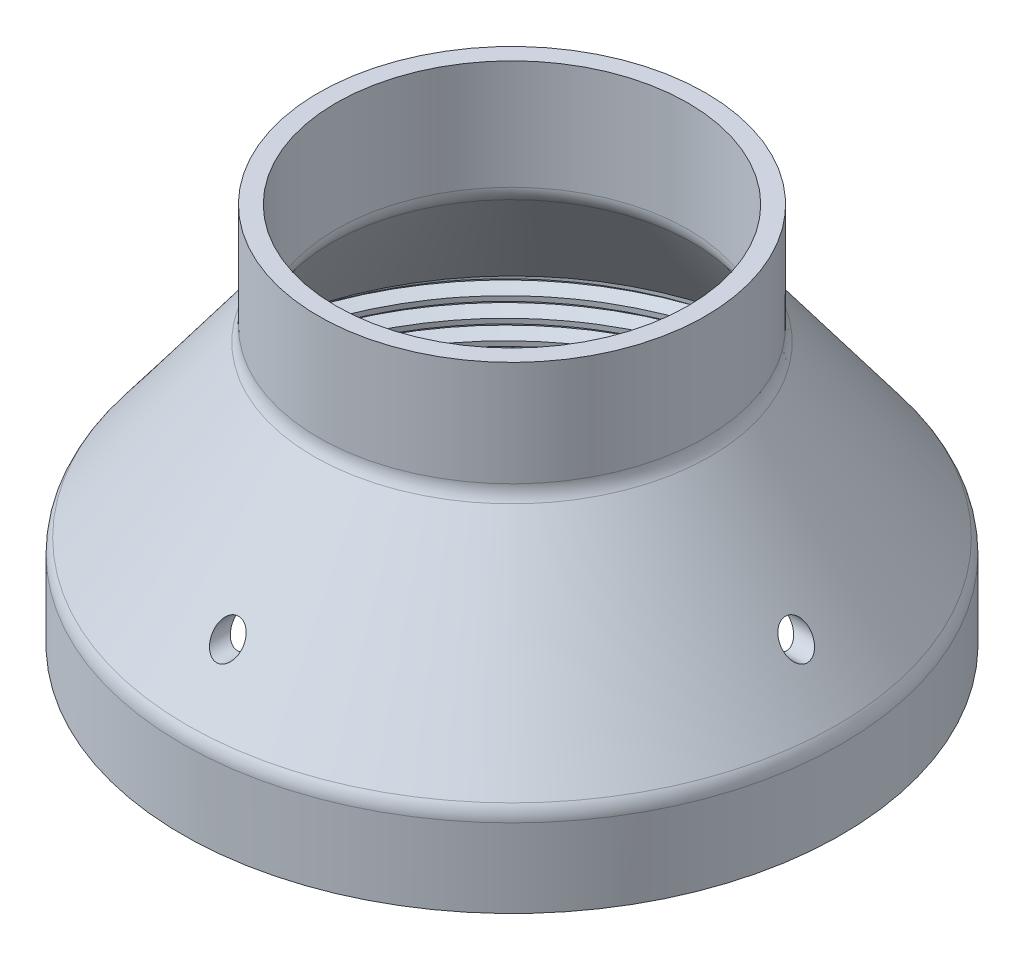
from build123d import *

# Parameters (mm, degrees)
CHAMFER1_SIZE      = 2.54
THREAD1_PITCH      = 2.116666667
FILLET1_R          = 2.54
SKETCH6_R          = 1.5875
CUT_EXTRUDE2_DEPTH = 66.197773391
CIRPATTERN1_COUNT  = 4


with BuildPart() as part:
    # Sketch1 → Revolve1 (revolve)
    with BuildSketch(Plane.XY, mode=Mode.PRIVATE) as revolve1_sk:
        Polygon((35.687, 0), (35.687, 9.343833915), (20.955, 29.039021081), (20.955, 41.275), (19.05, 41.275), (19.05, 28.575), (30.9245, 12.7), (30.9245, 0), align=None)
    revolve(revolve1_sk.sketch.rotate(Axis((0, 0, 0), (0, 1, 0)), 90), axis=Axis((0, 0, 0), (0, 1, 0)))

    # Chamfer1
    chamfer1_edges = [part.edges().sort_by_distance(p)[0] for p in [
        (0, 0, 30.9245),
    ]]
    chamfer(chamfer1_edges, length=CHAMFER1_SIZE)

    # Thread1: the profile of Thread Profile1 profile screwed along a right-hand helix of 6 turns, 10 arcs to a turn; built about Z, then put on its axis
    thread1_z = Axis((0, 0, 0), (0, 0, 1))
    thread1_corners = [(30.9242, 0, -0.000173205), (32.070179435, 0, 0.66145833), (32.070179435, 0, 0.926041664), (30.9242, 0, 1.587673199)]
    with BuildLine(mode=Mode.PRIVATE) as thread1_profile:
        Line(thread1_corners[0], thread1_corners[1])
        Line(thread1_corners[1], thread1_corners[2])
        Line(thread1_corners[2], thread1_corners[3])
        Line(thread1_corners[3], thread1_corners[0])
    thread1_cap = Face(thread1_profile.wire())
    thread1_turn_angles = [0, 18, 36, 54, 72, 90, 108, 126, 144, 162, 180, 198, 216, 234, 252, 270, 288, 306, 324, 342, 360]
    thread1_turn_weights = [1, 0.9510565162951535, 1, 0.9510565162951535, 1, 0.9510565162951535, 1, 0.9510565162951535, 1, 0.9510565162951535, 1, 0.9510565162951535, 1, 0.9510565162951535, 1, 0.9510565162951535, 1, 0.9510565162951535, 1, 0.9510565162951535, 1]
    thread1_turn_rails = [Edge.make_bspline([Vector(p[0], p[1], 0).rotate(thread1_z, thread1_turn_angles[k]) / thread1_turn_weights[k] + Vector(0, 0, p[2] + THREAD1_PITCH * thread1_turn_angles[k] / 360) for k in range(21)], [0, 0, 0, 1, 1, 2, 2, 3, 3, 4, 4, 5, 5, 6, 6, 7, 7, 8, 8, 9, 9, 10, 10, 10], 2, thread1_turn_weights) for p in thread1_corners]
    thread1_turn_sides = [Face.make_surface_from_curves(thread1_turn_rails[p[0]], thread1_turn_rails[p[1]]) for p in [(0, 1), (1, 2), (2, 3), (3, 0)]]
    thread1 = Plane(origin=(0, 12.7, 0), x_dir=(-1, 0, 0), z_dir=(0, -1, 0)) * Solid(Shell([*[p.moved(Location((0, 0, THREAD1_PITCH * i))) for i in range(6) for p in thread1_turn_sides], thread1_cap, thread1_cap.rotate(thread1_z, 2160).moved(Location((0, 0, THREAD1_PITCH * 2160 / 360)))]))
    add(thread1, mode=Mode.SUBTRACT)

    # Fillet1
    fillet1_edges = [part.edges().sort_by_distance(p)[0] for p in [
        (0, 28.575, 19.05),
        (0, 29.039021081, 20.955),
        (0, 9.343833915, 35.687),
    ]]
    fillet(fillet1_edges, radius=FILLET1_R)

    # Sketch6 → Cut-Extrude2 (cut, symmetric)
    with BuildSketch(Plane.XY):
        with Locations(Location((0, 15.875, 0), (0, 0, 215.876118616))):
            Circle(SKETCH6_R)
    cut_extrude2 = extrude(amount=CUT_EXTRUDE2_DEPTH, both=True, mode=Mode.SUBTRACT)

    # CirPattern1: Cut-Extrude2 ×4 about axis
    cirpattern1_axis = Axis((0, 41.275, 0), (0, -1, 0))
    for i in range(1, CIRPATTERN1_COUNT):
        add(cut_extrude2.rotate(cirpattern1_axis, i * 360 / CIRPATTERN1_COUNT), mode=Mode.SUBTRACT)


solid = part.part
